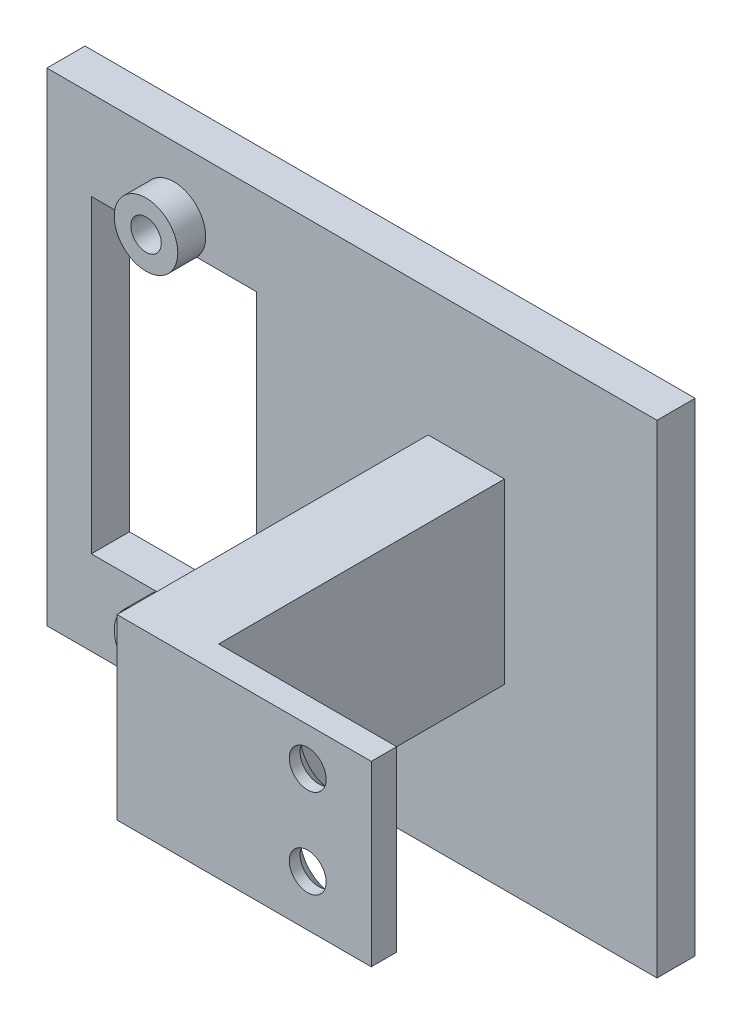
from build123d import *

# Parameters (mm, degrees)
SERVO_SHELF_START                        = -27.480025
SKETCH1_W                                = 48
SKETCH1_H                                = 38
SKETCH1_W_2                              = 13
SKETCH1_H_2                              = 24.35
SERVO_SHELF_DEPTH                        = 3
OUTBOARD_RISER_START                     = -25.480025
SKETCH2_W                                = 6
SKETCH2_H                                = 14
OUTBOARD_RISER_DEPTH                     = 24.480025
PLATE_ATTACHMENT_FOOT_START              = -2
SKETCH3_W                                = 20
SKETCH3_H                                = 14
PLATE_ATTACHMENT_FOOT_DEPTH              = 2
SKETCH4_R                                = 1.45
SERVO_PAD_D2P9_DEPTH                     = 2.01
SKETCH5_R                                = 2.6
SERVO_PAD_CSK_D5P2_90DEG_DEPTH           = 1.15
SERVO_PAD_CSK_D5P2_90DEG_DRAFT           = -45
SERVO_PAD_CSK_D5P2_90DEG_PROFILE_2_DEPTH = 1.15
SERVO_PAD_CSK_D5P2_90DEG_PROFILE_2_DRAFT = -45
SERVO_EAR_SUPPORTS_H2P2_START            = -24.480025
SKETCH6_R                                = 2.5
SERVO_EAR_SUPPORTS_H2P2_DEPTH            = 2.2
SKETCH7_R                                = 1.2
SERVO_EAR_D2P4_THROUGH_DEPTH             = 5.21


with BuildPart() as part:
    # Sketch1 → Servo_Shelf (new body)
    with BuildSketch(Plane.XY.offset(SERVO_SHELF_START)):
        with Locations((-46, 19)):
            Rectangle(SKETCH1_W, SKETCH1_H)
        with Locations((-60, 18.825)):
            Rectangle(SKETCH1_W_2, SKETCH1_H_2, mode=Mode.SUBTRACT)
    extrude(amount=SERVO_SHELF_DEPTH)

    # Sketch2 → Outboard_Riser (add)
    with BuildSketch(Plane.XY.offset(OUTBOARD_RISER_START)):
        with Locations((-37, 21)):
            Rectangle(SKETCH2_W, SKETCH2_H)
    extrude(amount=OUTBOARD_RISER_DEPTH)

    # Sketch3 → Plate_Attachment_Foot (add)
    with BuildSketch(Plane.XY.offset(PLATE_ATTACHMENT_FOOT_START)):
        with Locations((-30, 21)):
            Rectangle(SKETCH3_W, SKETCH3_H)
    extrude(amount=PLATE_ATTACHMENT_FOOT_DEPTH)

    # Sketch4 → Servo_Pad_D2p9 (cut)
    with BuildSketch(Plane(origin=(0, 0, -2), x_dir=(-1, 0, 0), z_dir=(0, 0, -1))):
        with Locations((25, 18)):
            Circle(SKETCH4_R)
        with Locations((25, 25)):
            Circle(SKETCH4_R)
    extrude(amount=-SERVO_PAD_D2P9_DEPTH, mode=Mode.SUBTRACT)


with BuildPart() as servo_pad_csk_d5p2_90deg_tool:
    # Sketch5 → Servo_Pad_CSK_D5p2_90deg (with draft: the straight prism first)
    with BuildSketch(Plane(origin=(0, 0, -2), x_dir=(-1, 0, 0), z_dir=(0, 0, -1))):
        with Locations((25, 18)):
            Circle(SKETCH5_R)
    extrude(amount=-SERVO_PAD_CSK_D5P2_90DEG_DEPTH)
    # Servo_Pad_CSK_D5p2_90deg: the draft: its side faces are tilted about the plane it starts from
    servo_pad_csk_d5p2_90deg_sides = [servo_pad_csk_d5p2_90deg_tool.faces().sort_by_distance(p)[0] for p in [
        (-22.4, 18, -1.425),
    ]]
    draft(servo_pad_csk_d5p2_90deg_sides, Plane(origin=(0, 0, -2), x_dir=(-1, 0, 0), z_dir=(0, 0, -1)), SERVO_PAD_CSK_D5P2_90DEG_DRAFT)


with BuildPart() as part_1:
    add(part.part)

    # Servo_Pad_CSK_D5p2_90deg: cut by servo_pad_csk_d5p2_90deg_tool
    add(servo_pad_csk_d5p2_90deg_tool.part, mode=Mode.SUBTRACT)


with BuildPart() as servo_pad_csk_d5p2_90deg_profile_2_tool:
    # Sketch5 → Servo_Pad_CSK_D5p2_90deg profile 2 (with draft: the straight prism first)
    with BuildSketch(Plane(origin=(0, 0, -2), x_dir=(-1, 0, 0), z_dir=(0, 0, -1))):
        with Locations((25, 25)):
            Circle(SKETCH5_R)
    extrude(amount=-SERVO_PAD_CSK_D5P2_90DEG_PROFILE_2_DEPTH)
    # Servo_Pad_CSK_D5p2_90deg profile 2: the draft: its side faces are tilted about the plane it starts from
    servo_pad_csk_d5p2_90deg_profile_2_sides = [servo_pad_csk_d5p2_90deg_profile_2_tool.faces().sort_by_distance(p)[0] for p in [
        (-22.4, 25, -1.425),
    ]]
    draft(servo_pad_csk_d5p2_90deg_profile_2_sides, Plane(origin=(0, 0, -2), x_dir=(-1, 0, 0), z_dir=(0, 0, -1)), SERVO_PAD_CSK_D5P2_90DEG_PROFILE_2_DRAFT)


with BuildPart() as part_2:
    add(part_1.part)

    # Servo_Pad_CSK_D5p2_90deg profile 2: cut by servo_pad_csk_d5p2_90deg_profile_2_tool
    add(servo_pad_csk_d5p2_90deg_profile_2_tool.part, mode=Mode.SUBTRACT)

    # Sketch6 → Servo_Ear_Supports_H2p2 (add)
    with BuildSketch(Plane.XY.offset(SERVO_EAR_SUPPORTS_H2P2_START)):
        with Locations((-60, 4.55)):
            Circle(SKETCH6_R)
        with Locations((-60, 32.75)):
            Circle(SKETCH6_R)
    extrude(amount=SERVO_EAR_SUPPORTS_H2P2_DEPTH)

    # Sketch7 → Servo_Ear_D2p4_Through (cut)
    with BuildSketch(Plane.XY.offset(-22.280025)):
        with Locations((-60, 4.55)):
            Circle(SKETCH7_R)
        with Locations((-60, 32.75)):
            Circle(SKETCH7_R)
    extrude(amount=-SERVO_EAR_D2P4_THROUGH_DEPTH, mode=Mode.SUBTRACT)


solid = part_2.part
